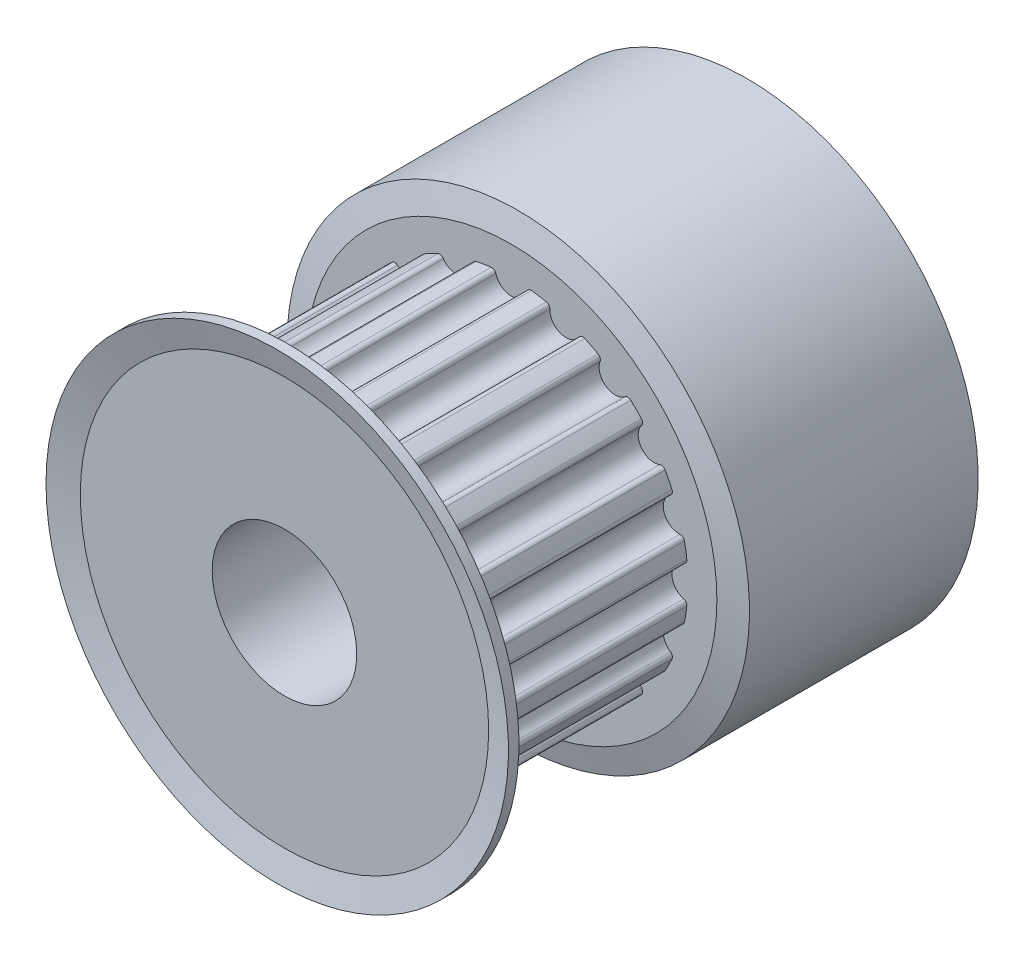
from build123d import *

# Parameters (mm, degrees)
SKETCH2_R          = 0.555
CUT_EXTRUDE1_DEPTH = 7.5
FILLET1_R          = 0.15


with BuildPart() as part:
    # Sketch1 → Revolve1 (revolve)
    with BuildSketch(Plane(origin=(0, 0, 0), x_dir=(0, 0, -1), z_dir=(1, 0, 0))):
        Polygon((0, -8), (0, -2.5), (-16, -2.5), (-16, -6.11), (-16, -7.063921626), (-16.250821444, -8), (-15.888474781, -8), (-15.65, -7.11), (-15.65, -6.11), (-8.15, -6.11), (-8.15, -7.11), (-7.911525219, -8), align=None)
    revolve(axis=Axis((0, 0, 0), (0, 0, 1)))

    # Sketch2 → Cut-Extrude1 (cut)
    with BuildSketch(Plane.XY.offset(8.15)):
        with Locations((0, 6.11)):
            Circle(SKETCH2_R)
        with Locations((1.888093836, 5.810955315)):
            Circle(SKETCH2_R)
        with Locations((3.591367892, 4.943093836)):
            Circle(SKETCH2_R)
        with Locations((4.943093836, 3.591367892)):
            Circle(SKETCH2_R)
        with Locations((5.810955315, 1.888093836)):
            Circle(SKETCH2_R)
        with Locations((6.11, 0)):
            Circle(SKETCH2_R)
        with Locations((5.810955315, -1.888093836)):
            Circle(SKETCH2_R)
        with Locations((4.943093836, -3.591367892)):
            Circle(SKETCH2_R)
        with Locations((3.591367892, -4.943093836)):
            Circle(SKETCH2_R)
        with Locations((1.888093836, -5.810955315)):
            Circle(SKETCH2_R)
        with Locations((0, -6.11)):
            Circle(SKETCH2_R)
        with Locations((-1.888093836, -5.810955315)):
            Circle(SKETCH2_R)
        with Locations((-3.591367892, -4.943093836)):
            Circle(SKETCH2_R)
        with Locations((-4.943093836, -3.591367892)):
            Circle(SKETCH2_R)
        with Locations((-5.810955315, -1.888093836)):
            Circle(SKETCH2_R)
        with Locations((-6.11, 0)):
            Circle(SKETCH2_R)
        with Locations((-5.810955315, 1.888093836)):
            Circle(SKETCH2_R)
        with Locations((-4.943093836, 3.591367892)):
            Circle(SKETCH2_R)
        with Locations((-3.591367892, 4.943093836)):
            Circle(SKETCH2_R)
        with Locations((-1.888093836, 5.810955315)):
            Circle(SKETCH2_R)
    extrude(amount=CUT_EXTRUDE1_DEPTH, mode=Mode.SUBTRACT)

    # Fillet1
    fillet1_edges = [part.edges().sort_by_distance(p)[0] for p in [
        (5.958309843, 1.353012867, 11.9),
        (6.084793372, 0.554427295, 11.9),
        (6.084793372, -0.554427295, 11.9),
        (5.958309843, -1.353012867, 11.9),
        (5.61565493, -2.407596251, 11.9),
        (5.248585433, -3.128010703, 11.9),
        (4.596817057, -4.025092911, 11.9),
        (4.025092911, -4.596817057, 11.9),
        (3.128010703, -5.248585433, 11.9),
        (2.407596251, -5.61565493, 11.9),
        (1.353012867, -5.958309843, 11.9),
        (0.554427295, -6.084793372, 11.9),
        (-0.554427295, -6.084793372, 11.9),
        (5.61565493, 2.407596251, 11.9),
        (5.248585433, 3.128010703, 11.9),
        (4.596817057, 4.025092911, 11.9),
        (4.025092911, 4.596817057, 11.9),
        (3.128010703, 5.248585433, 11.9),
        (2.407596251, 5.61565493, 11.9),
        (1.353012867, 5.958309843, 11.9),
        (0.554427295, 6.084793372, 11.9),
        (-0.554427295, 6.084793372, 11.9),
        (-1.353012867, 5.958309843, 11.9),
        (-2.407596251, 5.61565493, 11.9),
        (-3.128010703, 5.248585433, 11.9),
        (-1.353012867, -5.958309843, 11.9),
        (-2.407596251, -5.61565493, 11.9),
        (-3.128010703, -5.248585433, 11.9),
        (-4.025092911, -4.596817057, 11.9),
        (-4.596817057, -4.025092911, 11.9),
        (-5.248585433, -3.128010703, 11.9),
        (-5.61565493, -2.407596251, 11.9),
        (-5.958309843, -1.353012867, 11.9),
        (-6.084793372, -0.554427295, 11.9),
        (-6.084793372, 0.554427295, 11.9),
        (-5.958309843, 1.353012867, 11.9),
        (-5.248585433, 3.128010703, 11.9),
        (-5.61565493, 2.407596251, 11.9),
        (-4.025092911, 4.596817057, 11.9),
        (-4.596817057, 4.025092911, 11.9),
    ]]
    fillet(fillet1_edges, radius=FILLET1_R)


solid = part.part
